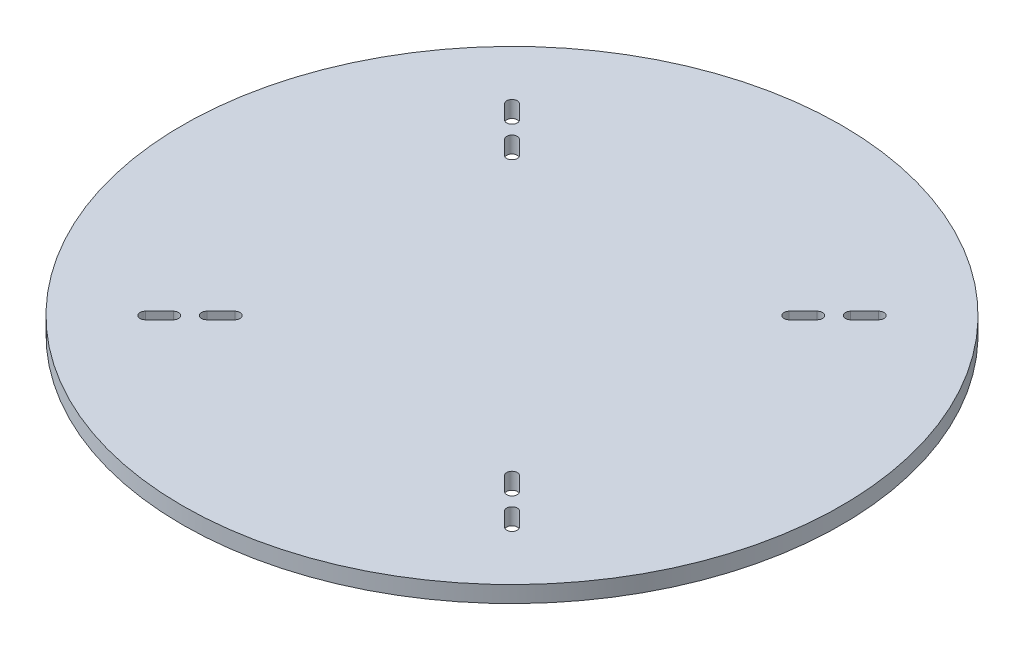
from build123d import *

# Parameters (mm, degrees)
SKETCH1_R           = 127
BOSS_EXTRUDE1_DEPTH = 6.35
CUT_EXTRUDE1_DEPTH  = 180.717340566


with BuildPart() as part:
    # Sketch1 → Boss-Extrude1 (new body)
    with BuildSketch(Plane(origin=(0, 0, 0), x_dir=(1, 0, 0), z_dir=(0, 1, 0))):
        Circle(SKETCH1_R)
    extrude(amount=BOSS_EXTRUDE1_DEPTH)

    # Sketch2 → Cut-Extrude1 (cut, through all)
    with BuildSketch(Plane(origin=(0, 6.35, 0), x_dir=(1, 0, 0), z_dir=(0, 1, 0))):
        with BuildLine():
            Line((-63.829594426, 66.703276385), (-69.217748099, 72.091430058))
            ThreePointArc((-69.217748099, 72.091430058), (-72.091430058, 72.091430058), (-72.091430058, 69.217748099))
            Line((-72.091430058, 69.217748099), (-66.703276385, 63.829594426))
            ThreePointArc((-66.703276385, 63.829594426), (-63.829594426, 63.829594426), (-63.829594426, 66.703276385))
        make_face()
        with BuildLine():
            Line((-51.975656347, 54.849338305), (-57.363810019, 60.237491978))
            ThreePointArc((-57.363810019, 60.237491978), (-60.237491978, 60.237491978), (-60.237491978, 57.363810019))
            Line((-60.237491978, 57.363810019), (-54.849338305, 51.975656347))
            ThreePointArc((-54.849338305, 51.975656347), (-51.975656347, 51.975656347), (-51.975656347, 54.849338305))
        make_face()
        with BuildLine():
            ThreePointArc((60.237491978, 57.363810019), (60.237491978, 60.237491978), (57.363810019, 60.237491978))
            Line((57.363810019, 60.237491978), (51.975656347, 54.849338305))
            ThreePointArc((51.975656347, 54.849338305), (51.975656347, 51.975656347), (54.849338305, 51.975656347))
            Line((54.849338305, 51.975656347), (60.237491978, 57.363810019))
        make_face()
        with BuildLine():
            ThreePointArc((72.091430058, 69.217748099), (72.091430058, 72.091430058), (69.217748099, 72.091430058))
            Line((69.217748099, 72.091430058), (63.829594426, 66.703276385))
            ThreePointArc((63.829594426, 66.703276385), (63.829594426, 63.829594426), (66.703276385, 63.829594426))
            Line((66.703276385, 63.829594426), (72.091430058, 69.217748099))
        make_face()
        with BuildLine():
            Line((63.829594426, -66.703276385), (69.217748099, -72.091430058))
            ThreePointArc((69.217748099, -72.091430058), (72.091430058, -72.091430058), (72.091430058, -69.217748099))
            Line((72.091430058, -69.217748099), (66.703276385, -63.829594426))
            ThreePointArc((66.703276385, -63.829594426), (63.829594426, -63.829594426), (63.829594426, -66.703276385))
        make_face()
        with BuildLine():
            Line((51.975656347, -54.849338305), (57.363810019, -60.237491978))
            ThreePointArc((57.363810019, -60.237491978), (60.237491978, -60.237491978), (60.237491978, -57.363810019))
            Line((60.237491978, -57.363810019), (54.849338305, -51.975656347))
            ThreePointArc((54.849338305, -51.975656347), (51.975656347, -51.975656347), (51.975656347, -54.849338305))
        make_face()
        with BuildLine():
            ThreePointArc((-60.237491978, -57.363810019), (-60.237491978, -60.237491978), (-57.363810019, -60.237491978))
            Line((-57.363810019, -60.237491978), (-51.975656347, -54.849338305))
            ThreePointArc((-51.975656347, -54.849338305), (-51.975656347, -51.975656347), (-54.849338305, -51.975656347))
            Line((-54.849338305, -51.975656347), (-60.237491978, -57.363810019))
        make_face()
        with BuildLine():
            ThreePointArc((-72.091430058, -69.217748099), (-72.091430058, -72.091430058), (-69.217748099, -72.091430058))
            Line((-69.217748099, -72.091430058), (-63.829594426, -66.703276385))
            ThreePointArc((-63.829594426, -66.703276385), (-63.829594426, -63.829594426), (-66.703276385, -63.829594426))
            Line((-66.703276385, -63.829594426), (-72.091430058, -69.217748099))
        make_face()
    extrude(amount=-CUT_EXTRUDE1_DEPTH, mode=Mode.SUBTRACT)


solid = part.part
